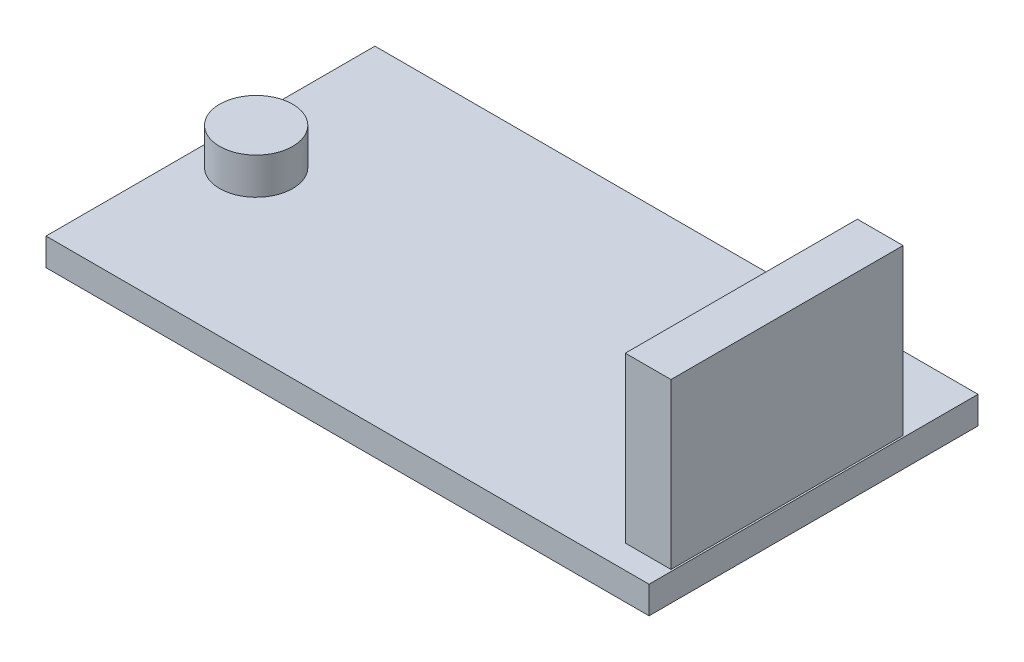
from build123d import *

# Parameters (mm, degrees)
SKETCH1_W           = 33
SKETCH1_H           = 18
BOSS_EXTRUDE1_DEPTH = 1.5
SKETCH2_W           = 2.5
SKETCH2_H           = 12.7
BOSS_EXTRUDE2_DEPTH = 9
SKETCH3_R           = 2
BOSS_EXTRUDE3_DEPTH = 2


with BuildPart() as part:
    # Sketch1 → Boss-Extrude1 (new body)
    with BuildSketch(Plane(origin=(0, 0, 0), x_dir=(1, 0, 0), z_dir=(0, 1, 0))):
        Rectangle(SKETCH1_W, SKETCH1_H)
    extrude(amount=BOSS_EXTRUDE1_DEPTH)

    # Sketch2 → Boss-Extrude2 (add)
    with BuildSketch(Plane(origin=(0, 1.5, 0), x_dir=(1, 0, 0), z_dir=(0, 1, 0))):
        with Locations((15.15, -1.35)):
            Rectangle(SKETCH2_W, SKETCH2_H)
    extrude(amount=BOSS_EXTRUDE2_DEPTH)

    # Sketch3 → Boss-Extrude3 (add)
    with BuildSketch(Plane(origin=(0, 1.5, 0), x_dir=(1, 0, 0), z_dir=(0, 1, 0))):
        with Locations((-14, 0)):
            Circle(SKETCH3_R)
    extrude(amount=BOSS_EXTRUDE3_DEPTH)


solid = part.part
